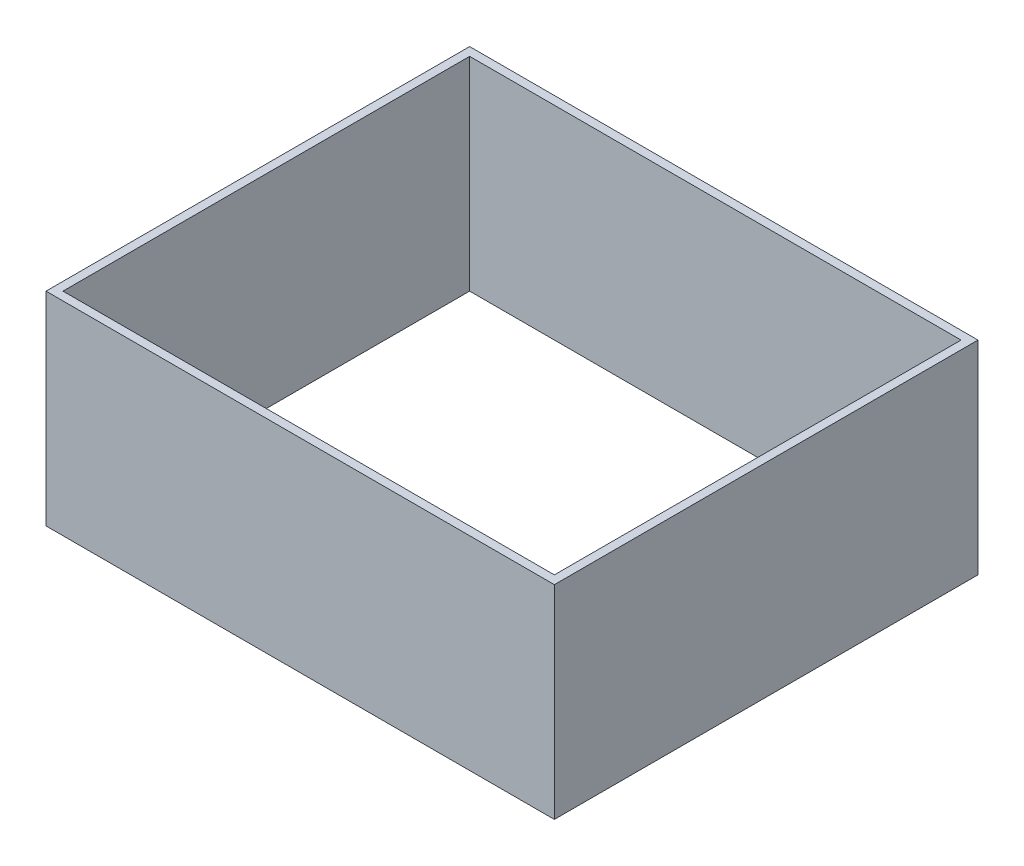
from build123d import *

# Parameters (mm, degrees)
SKETCH1_W           = 150
SKETCH1_H           = 125
BOSS_EXTRUDE1_DEPTH = 60
SHELL1_T            = -2.5


with BuildPart() as part:
    # Sketch1 → Boss-Extrude1 (new body)
    with BuildSketch(Plane(origin=(0, 0, 0), x_dir=(1, 0, 0), z_dir=(0, 1, 0))):
        Rectangle(SKETCH1_W, SKETCH1_H)
    extrude(amount=BOSS_EXTRUDE1_DEPTH)

    # Shell1
    shell1_openings = [part.faces().sort_by_distance(p)[0] for p in [
        (0, 0, 0),
        (0, 60, 0),
    ]]
    offset(amount=SHELL1_T, openings=shell1_openings, kind=Kind.INTERSECTION)


solid = part.part
